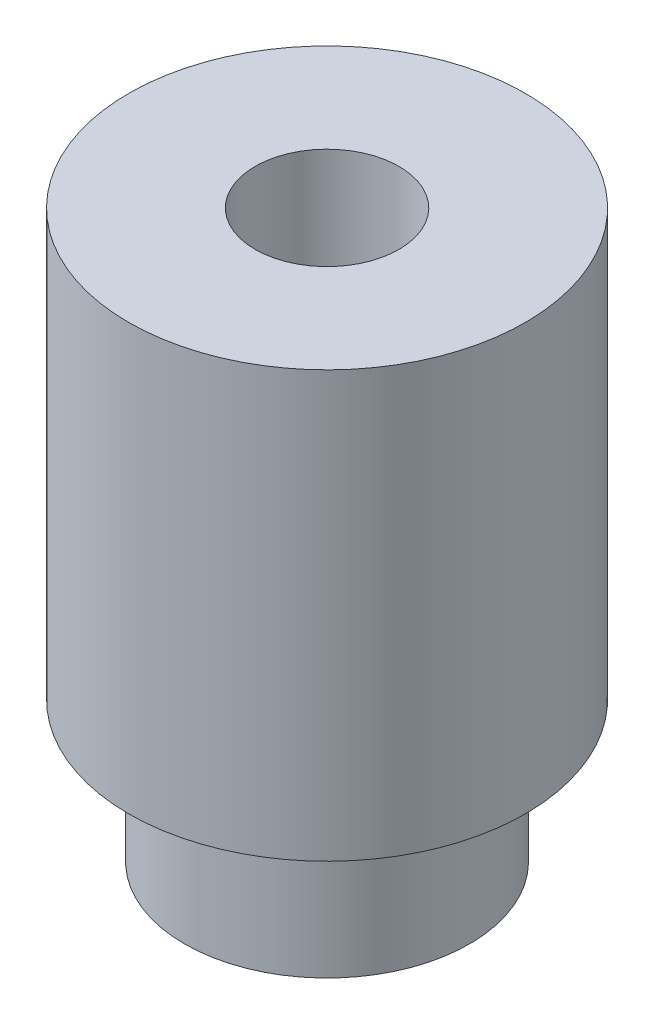
from build123d import *

# Parameters (mm, degrees)
SKETCH1_R           = 10.033
BOSS_EXTRUDE1_DEPTH = 9.906
SKETCH2_R           = 13.97
BOSS_EXTRUDE2_DEPTH = 29.972
SKETCH3_R           = 5.0673
CUT_EXTRUDE1_DEPTH  = 45.503670455


with BuildPart() as part:
    # Sketch1 → Boss-Extrude1 (new body)
    with BuildSketch(Plane(origin=(0, 0, 0), x_dir=(1, 0, 0), z_dir=(0, 1, 0))):
        Circle(SKETCH1_R)
    extrude(amount=BOSS_EXTRUDE1_DEPTH)

    # Sketch2 → Boss-Extrude2 (add)
    with BuildSketch(Plane(origin=(0, 9.906, 0), x_dir=(1, 0, 0), z_dir=(0, 1, 0))):
        Circle(SKETCH2_R)
    extrude(amount=BOSS_EXTRUDE2_DEPTH)

    # Sketch3 → Cut-Extrude1 (cut, through all)
    with BuildSketch(Plane(origin=(0, 39.878, 0), x_dir=(1, 0, 0), z_dir=(0, 1, 0))):
        Circle(SKETCH3_R)
    extrude(amount=-CUT_EXTRUDE1_DEPTH, mode=Mode.SUBTRACT)


solid = part.part
